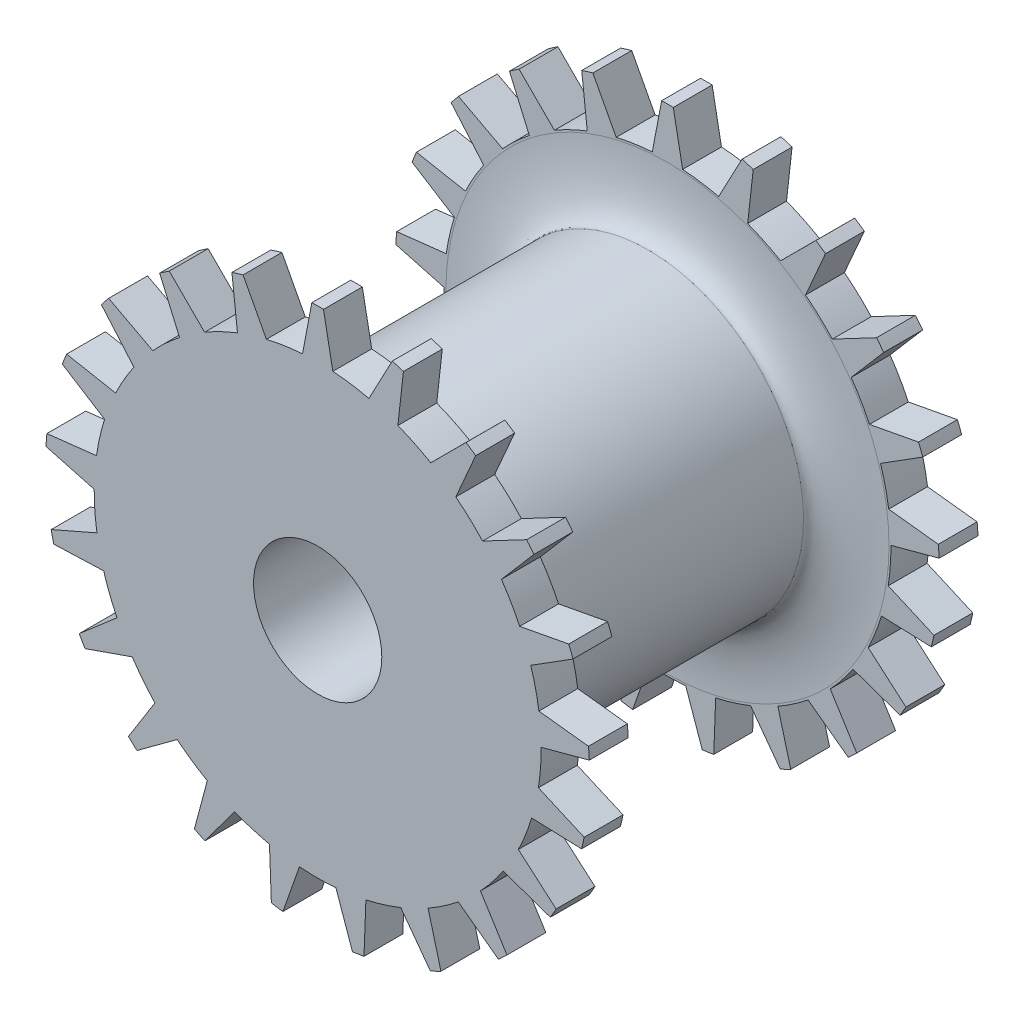
from build123d import *

# Parameters (mm, degrees)
EXTRUDE_1_DEPTH          = 5
CUT_EXTRUDE_1_DEPTH      = 12.084248508
CUT_EXTRUDE_1_DEPTH_BACK = 12.084248508
SKETCH_2_R               = 1.65
SKETCH_3_R               = 3
CUT_EXTRUDE_2_DEPTH      = 12.084248508
CUT_EXTRUDE_START        = 2
SKETCH_4_R               = 3
CUT_EXTRUDE_3_DEPTH      = 2
SKETCH_5_R               = 7.819381441
SKETCH_5_R_2             = 5
CUT_EXTRUDE_4_DEPTH      = 4
SKETCH_6_R               = 8.231622196
SKETCH_6_R_2             = 4
CUT_EXTRUDE_5_DEPTH      = 4
CUT_EXTRUDE_START_2      = -4
SKETCH_7_R               = 7.467369794
SKETCH_7_R_2             = 4
CUT_EXTRUDE_6_DEPTH      = 4
FILLET_1_SIZE            = 1.7
FILLET_1_SIZE_2          = 0.5
FILLET_2_SIZE            = 0.5
FILLET_2_SIZE_2          = 1.7


with BuildPart() as part:
    # 草图1 → 凸台-拉伸1 (new, symmetric)
    with BuildSketch(Plane.XY):
        with BuildLine():
            Line((-0.15, 6.998392673), (-0.39, 5.736758667))
            ThreePointArc((-0.39, 5.736758667), (-0.8571042, 5.685760494), (-1.318484768, 5.596793539))
            Line((-1.318484768, 5.596793539), (-1.919476532, 6.731686998))
            ThreePointArc((-1.919476532, 6.731686998), (-2.063286221, 6.689009641), (-2.206148374, 6.643260446))
            Line((-2.206148374, 6.643260446), (-2.063612696, 5.366936057))
            ThreePointArc((-2.063612696, 5.366936057), (-2.494932791, 5.18052221), (-2.909592044, 4.959513498))
            Line((-2.909592044, 4.959513498), (-3.818399151, 5.866841393))
            ThreePointArc((-3.818399151, 5.866841393), (-3.943240406, 5.78367142), (-4.066270783, 5.697845375))
            Line((-4.066270783, 5.697845375), (-3.553864347, 4.520237627))
            ThreePointArc((-3.553864347, 4.520237627), (-3.911075655, 4.214971794), (-4.2421693, 3.881558918))
            Line((-4.2421693, 3.881558918), (-5.378040248, 4.480701183))
            ThreePointArc((-5.378040248, 4.480701183), (-5.472820377, 4.364428613), (-5.565087188, 4.246151738))
            Line((-5.565087188, 4.246151738), (-4.728339556, 3.271896246))
            ThreePointArc((-4.728339556, 3.271896246), (-4.979702283, 2.874902636), (-5.197811196, 2.458710794))
            Line((-5.197811196, 2.458710794), (-6.459818868, 2.69643101))
            ThreePointArc((-6.459818868, 2.69643101), (-6.516116241, 2.557387171), (-6.569421175, 2.417168886))
            Line((-6.569421175, 2.417168886), (-5.482681045, 1.732832526))
            ThreePointArc((-5.482681045, 1.732832526), (-5.605860511, 1.279385764), (-5.691604758, 0.817395427))
            Line((-5.691604758, 0.817395427), (-6.967614233, 0.672571109))
            ThreePointArc((-6.967614233, 0.672571109), (-6.98042658, 0.523110655), (-6.990033261, 0.37340997))
            Line((-6.990033261, 0.37340997), (-5.749862262, 0.039799031))
            ThreePointArc((-5.749862262, 0.039799031), (-5.733913431, -0.429810149), (-5.679674259, -0.896549112))
            Line((-5.679674259, -0.896549112), (-6.856306497, -1.411049687))
            ThreePointArc((-6.856306497, -1.411049687), (-6.824495385, -1.557646538), (-6.789550217, -1.703528061))
            Line((-6.789550217, -1.703528061), (-5.506142985, -1.656770782))
            ThreePointArc((-5.506142985, -1.656770782), (-5.35248298, -2.100815543), (-5.163079778, -2.530831327))
            Line((-5.163079778, -2.530831327), (-6.13578584, -3.369292526))
            ThreePointArc((-6.13578584, -3.369292526), (-6.062177826, -3.5), (-5.98578584, -3.629100147))
            Line((-5.98578584, -3.629100147), (-4.773178741, -3.206129241))
            ThreePointArc((-4.773178741, -3.206129241), (-4.495460927, -3.585154258), (-4.187723001, -3.940238073))
            Line((-4.187723001, -3.940238073), (-4.870073685, -5.028158938))
            ThreePointArc((-4.870073685, -5.028158938), (-4.761209164, -5.131363103), (-4.650158123, -5.232210759))
            Line((-4.650158123, -5.232210759), (-3.616096618, -4.470609047))
            ThreePointArc((-3.616096618, -4.470609047), (-3.238997443, -4.750936283), (-2.840268657, -4.999537374))
            Line((-2.840268657, -4.999537374), (-3.171634111, -6.240251363))
            ThreePointArc((-3.171634111, -6.240251363), (-3.037186174, -6.306782075), (-2.90134345, -6.370416484))
            Line((-2.90134345, -6.370416484), (-2.137708442, -5.33785562))
            ThreePointArc((-2.137708442, -5.33785562), (-1.694734822, -5.49457677), (-1.240443979, -5.61460584))
            Line((-1.240443979, -5.61460584), (-1.191380927, -6.897870069))
            ThreePointArc((-1.191380927, -6.897870069), (-1.043295863, -6.921815784), (-0.89473168, -6.942582749))
            Line((-0.89473168, -6.942582749), (-0.46937549, -5.730810296))
            ThreePointArc((-0.46937549, -5.730810296), (0.000112425, -5.749999999), (0.46959959, -5.730791937))
            Line((0.46959959, -5.730791937), (0.89473168, -6.942582749))
            ThreePointArc((0.89473168, -6.942582749), (1.043295863, -6.921815784), (1.191380927, -6.897870069))
            Line((1.191380927, -6.897870069), (1.240663534, -5.614557328))
            ThreePointArc((1.240663534, -5.614557328), (1.694949683, -5.494510494), (2.137917174, -5.337772022))
            Line((2.137917174, -5.337772022), (2.90134345, -6.370416484))
            ThreePointArc((2.90134345, -6.370416484), (3.037186174, -6.306782075), (3.171634111, -6.240251363))
            Line((3.171634111, -6.240251363), (2.840464159, -4.999426303))
            ThreePointArc((2.840464159, -4.999426303), (3.239183223, -4.75080962), (3.616271436, -4.470467638))
            Line((3.616271436, -4.470467638), (4.650158123, -5.232210759))
            ThreePointArc((4.650158123, -5.232210759), (4.761209164, -5.131363103), (4.870073685, -5.028158938))
            Line((4.870073685, -5.028158938), (4.187877078, -3.940074311))
            ThreePointArc((4.187877078, -3.940074311), (4.495601119, -3.584978462), (4.773304111, -3.205942586))
            Line((4.773304111, -3.205942586), (5.98578584, -3.629100147))
            ThreePointArc((5.98578584, -3.629100147), (6.062177826, -3.5), (6.13578584, -3.369292526))
            Line((6.13578584, -3.369292526), (5.163178741, -2.530629426))
            ThreePointArc((5.163178741, -2.530629426), (5.352565127, -2.100606236), (5.506207768, -1.656555466))
            Line((5.506207768, -1.656555466), (6.789550217, -1.703528061))
            ThreePointArc((6.789550217, -1.703528061), (6.824495385, -1.557646538), (6.856306497, -1.411049687))
            Line((6.856306497, -1.411049687), (5.679709314, -0.896327011))
            ThreePointArc((5.679709314, -0.896327011), (5.733930234, -0.429585927), (5.749860702, 0.040023876))
            Line((5.749860702, 0.040023876), (6.990033261, 0.37340997))
            ThreePointArc((6.990033261, 0.37340997), (6.98042658, 0.523110655), (6.967614233, 0.672571109))
            Line((6.967614233, 0.672571109), (5.691572789, 0.817617993))
            ThreePointArc((5.691572789, 0.817617993), (5.605810477, 1.279604976), (5.482613279, 1.733046922))
            Line((5.482613279, 1.733046922), (6.569421175, 2.417168886))
            ThreePointArc((6.569421175, 2.417168886), (6.516116241, 2.557387171), (6.459818868, 2.69643101))
            Line((6.459818868, 2.69643101), (5.197715046, 2.45891405))
            ThreePointArc((5.197715046, 2.45891405), (4.979589858, 2.875097363), (4.728211606, 3.272081143))
            Line((4.728211606, 3.272081143), (5.565087188, 4.246151738))
            ThreePointArc((5.565087188, 4.246151738), (5.472820377, 4.364428613), (5.378040248, 4.480701183))
            Line((5.378040248, 4.480701183), (4.24201751, 3.881724803))
            ThreePointArc((4.24201751, 3.881724803), (3.910910828, 4.215124731), (3.553687583, 4.520376595))
            Line((3.553687583, 4.520376595), (4.066270783, 5.697845375))
            ThreePointArc((4.066270783, 5.697845375), (3.943240406, 5.78367142), (3.818399151, 5.866841393))
            Line((3.818399151, 5.866841393), (2.909398103, 4.959627272))
            ThreePointArc((2.909398103, 4.959627272), (2.494730208, 5.180619769), (2.063402823, 5.36701675))
            Line((2.063402823, 5.36701675), (2.206148374, 6.643260446))
            ThreePointArc((2.206148374, 6.643260446), (2.063286221, 6.689009641), (1.919476532, 6.731686998))
            Line((1.919476532, 6.731686998), (1.318265907, 5.596845093))
            ThreePointArc((1.318265907, 5.596845093), (0.856881861, 5.685794006), (0.389775667, 5.736773913))
            Line((0.389775667, 5.736773913), (0.15, 6.998392673))
            ThreePointArc((0.15, 6.998392673), (0, 7), (-0.15, 6.998392673))
        make_face()
    extrude(amount=EXTRUDE_1_DEPTH, both=True)

    # 草图2 → 切除-拉伸1 (cut, two sides: drawn at the far end of the back side and taken through both)
    with BuildSketch(Plane.XY.offset(-CUT_EXTRUDE_1_DEPTH_BACK)):
        Circle(SKETCH_2_R)
    extrude(amount=CUT_EXTRUDE_1_DEPTH + CUT_EXTRUDE_1_DEPTH_BACK, mode=Mode.SUBTRACT)

    # 草图3 → 切除-拉伸2 (cut, through all)
    with BuildSketch(Plane.XY):
        Circle(SKETCH_3_R)
    extrude(amount=-CUT_EXTRUDE_2_DEPTH, mode=Mode.SUBTRACT)

    # 草图4 → 切除-拉伸3 (cut)
    with BuildSketch(Plane.XY.offset(CUT_EXTRUDE_START)):
        Circle(SKETCH_4_R)
    extrude(amount=-CUT_EXTRUDE_3_DEPTH, mode=Mode.SUBTRACT)

    # 草图5 → 切除-拉伸4 (cut, symmetric)
    with BuildSketch(Plane.XY):
        Circle(SKETCH_5_R)
        Circle(SKETCH_5_R_2, mode=Mode.SUBTRACT)
    extrude(amount=CUT_EXTRUDE_4_DEPTH, both=True, mode=Mode.SUBTRACT)

    # 草图6 → 切除-拉伸5 (cut)
    with BuildSketch(Plane.XY):
        Circle(SKETCH_6_R)
        Circle(SKETCH_6_R_2, mode=Mode.SUBTRACT)
    extrude(amount=CUT_EXTRUDE_5_DEPTH, mode=Mode.SUBTRACT)

    # 草图7 → 切除-拉伸6 (cut)
    with BuildSketch(Plane.XY.offset(CUT_EXTRUDE_START_2)):
        Circle(SKETCH_7_R)
        Circle(SKETCH_7_R_2, mode=Mode.SUBTRACT)
    extrude(amount=CUT_EXTRUDE_6_DEPTH, mode=Mode.SUBTRACT)

    # 圆角1
    # an asymmetric fillet: 1.7, 0.5 mm, written as the material it adds along each edge
    with BuildSketch(Plane(origin=(0, 0, 4), x_dir=(1, 0, 0), z_dir=(0, -1, 0))) as fillet_1_piece_1:
        with BuildLine():
            Bezier((4 + FILLET_1_SIZE, 0), (4, 0), (4, -FILLET_1_SIZE_2), weights=[1, 0.707106781, 1])
            Line((4, -FILLET_1_SIZE_2), (4, 0))
            Line((4, 0), (4 + FILLET_1_SIZE, 0))
        make_face()
    revolve(axis=Axis((0, 0, 4), (0, 0, 1)))

    # 圆角2
    # an asymmetric fillet: 1.7, 0.5 mm, written as the material it adds along each edge
    with BuildSketch(Plane(origin=(0, 0, -4), x_dir=(1, 0, 0), z_dir=(0, -1, 0))) as fillet_2_piece_1:
        with BuildLine():
            Bezier((4, FILLET_2_SIZE), (4, 0), (4 + FILLET_2_SIZE_2, 0), weights=[1, 0.707106781, 1])
            Line((4 + FILLET_2_SIZE_2, 0), (4, 0))
            Line((4, 0), (4, FILLET_2_SIZE))
        make_face()
    revolve(axis=Axis((0, 0, -4), (0, 0, 1)))


solid = part.part
